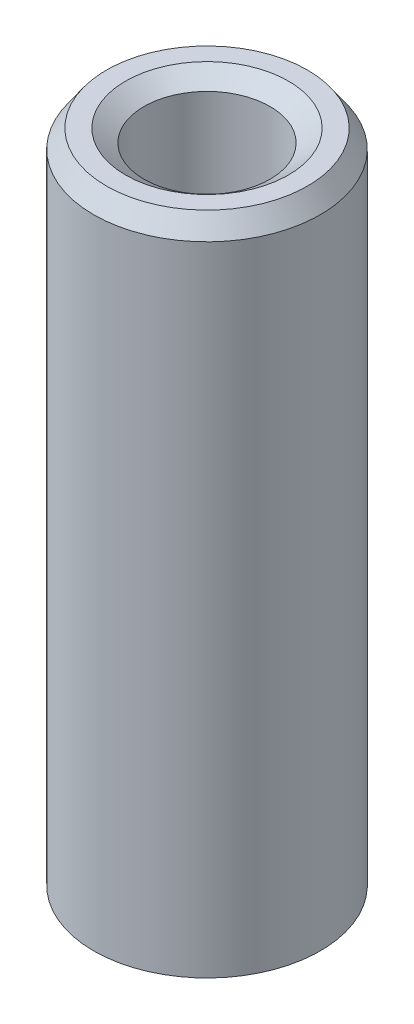
from build123d import *
from OCP.BRepFilletAPI import BRepFilletAPI_MakeChamfer

# Parameters (mm, degrees)
SKETCH1_R           = 22.5
BOSS_EXTRUDE1_DEPTH = 132.739767357
SKETCH2_R           = 12.514097778
CUT_EXTRUDE1_DEPTH  = 137.500351055
CHAMFER1_SIZE       = 3.649464384
CHAMFER1_SIZE2      = 2.545500532


with BuildPart() as part:
    # Sketch1 → Boss-Extrude1 (new body)
    with BuildSketch(Plane(origin=(0, 0, 0), x_dir=(1, 0, 0), z_dir=(0, 1, 0))):
        Circle(SKETCH1_R)
    extrude(amount=BOSS_EXTRUDE1_DEPTH)

    # Sketch2 → Cut-Extrude1 (cut, through all)
    with BuildSketch(Plane(origin=(0, 0, 0), x_dir=(1, 0, 0), z_dir=(0, 1, 0))):
        Circle(SKETCH2_R)
    extrude(amount=CUT_EXTRUDE1_DEPTH, mode=Mode.SUBTRACT)

    # Chamfer1: one chamfer whose edges measure the first distance from different faces: ONE call of the kernel's chamfer builder (chamfer() names one face for all edges)
    chamfer1_edges_1 = [part.edges().sort_by_distance(p)[0] for p in [
        (-12.514097778, 132.739767357, 0),
    ]]
    chamfer1_side_1 = [part.faces().sort_by_distance(p)[0] for p in [
        (-21.863603897, 132.739767357, 0),
    ]]
    chamfer1_edges_2 = [part.edges().sort_by_distance(p)[0] for p in [
        (-12.514097778, 0, 0),
    ]]
    chamfer1_side_2 = [part.faces().sort_by_distance(p)[0] for p in [
        (-12.514097778, 66.369883679, 0),
    ]]
    chamfer1_edges_3 = [part.edges().sort_by_distance(p)[0] for p in [
        (-22.5, 0, 0),
    ]]
    chamfer1_side_3 = [part.faces().sort_by_distance(p)[0] for p in [
        (-21.863603897, 0, 0),
    ]]
    chamfer1_edges_4 = [part.edges().sort_by_distance(p)[0] for p in [
        (-22.5, 132.739767357, 0),
    ]]
    chamfer1_side_4 = [part.faces().sort_by_distance(p)[0] for p in [
        (-22.5, 66.369883679, 0),
    ]]
    chamfer1 = BRepFilletAPI_MakeChamfer(part.part.solid().wrapped)
    for e in chamfer1_edges_1:
        chamfer1.Add(CHAMFER1_SIZE, CHAMFER1_SIZE2, e.wrapped, chamfer1_side_1[0].wrapped)  # the first distance lies on this face
    for e in chamfer1_edges_2:
        chamfer1.Add(CHAMFER1_SIZE, CHAMFER1_SIZE2, e.wrapped, chamfer1_side_2[0].wrapped)  # the first distance lies on this face
    for e in chamfer1_edges_3:
        chamfer1.Add(CHAMFER1_SIZE, CHAMFER1_SIZE2, e.wrapped, chamfer1_side_3[0].wrapped)  # the first distance lies on this face
    for e in chamfer1_edges_4:
        chamfer1.Add(CHAMFER1_SIZE, CHAMFER1_SIZE2, e.wrapped, chamfer1_side_4[0].wrapped)  # the first distance lies on this face
    add(Compound.cast(chamfer1.Shape()), mode=Mode.REPLACE)


solid = part.part
